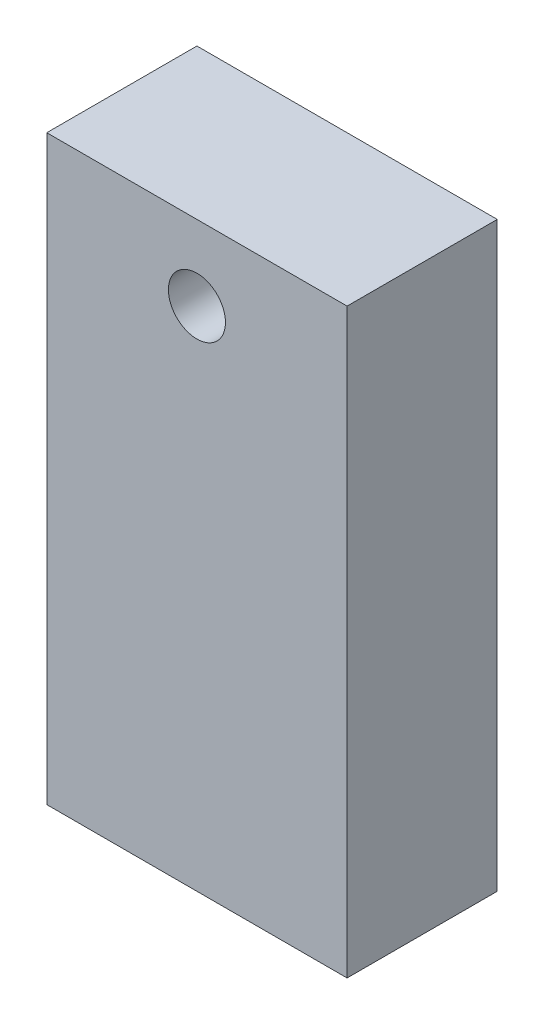
from build123d import *

# Parameters (mm, degrees)
SKETCH2_W           = 50.8
SKETCH2_H           = 25.4
BOSS_EXTRUDE1_DEPTH = 98.425
SKETCH3_R           = 4.826
CUT_EXTRUDE1_DEPTH  = 114.636616568
SKETCH4_R           = 2.667
CUT_EXTRUDE2_DEPTH  = 19.05


with BuildPart() as part:
    # Sketch2 → Boss-Extrude1 (new body)
    with BuildSketch(Plane(origin=(0, 0, 0), x_dir=(1, 0, 0), z_dir=(0, 1, 0))):
        with Locations((25.4, 12.7)):
            Rectangle(SKETCH2_W, SKETCH2_H)
    extrude(amount=BOSS_EXTRUDE1_DEPTH)

    # Sketch3 → Cut-Extrude1 (cut, through all)
    with BuildSketch(Plane.XY):
        with Locations((25.4, 85.725)):
            Circle(SKETCH3_R)
    extrude(amount=-CUT_EXTRUDE1_DEPTH, mode=Mode.SUBTRACT)

    # Sketch4 → Cut-Extrude2 (cut)
    with BuildSketch(Plane(origin=(0, 0, 0), x_dir=(-1, 0, 0), z_dir=(0, -1, 0))):
        with Locations((-12.7, 6.35)):
            Circle(SKETCH4_R)
        with Locations((-38.1, 6.35)):
            Circle(SKETCH4_R)
    extrude(amount=-CUT_EXTRUDE2_DEPTH, mode=Mode.SUBTRACT)


solid = part.part
